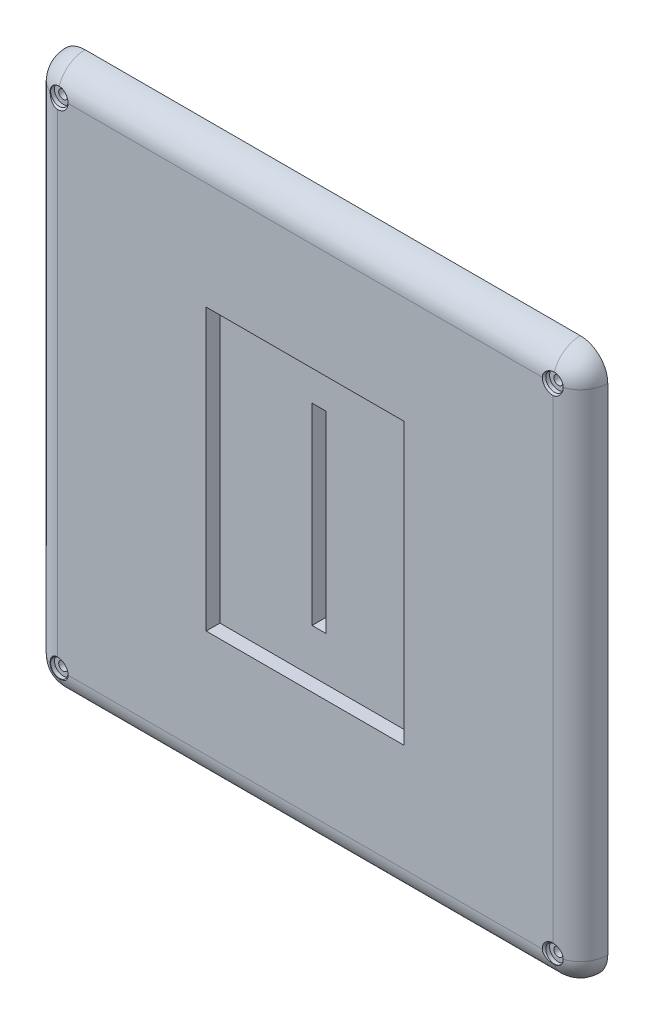
from build123d import *

# Parameters (mm, degrees)
CROQUIS3_W                                  = 200
CROQUIS3_H                                  = 200
SALIENTE_EXTRUIR1_DEPTH                     = 10
CROQUIS4_W                                  = 72
CROQUIS4_H                                  = 102
CORTAR_EXTRUIR2_DEPTH                       = 5
CROQUIS5_W                                  = 5
CROQUIS5_H                                  = 70
CORTAR_EXTRUIR3_DEPTH                       = 142.774468788
REDONDEO1_R                                 = 10
REDONDEO2_R                                 = 10
REDONDEO3_R                                 = 10
REDONDEO4_R                                 = 10
REDONDEO5_R                                 = 10
REFRENTADO_PARA_TORNILLO_CON_CABEZA_2_COUNT = 2
REFRENTADO_PARA_TORNILLO_CON_CABEZA_2_PITCH = 180
REFRENTADO_PARA_TORNILLO_CON_CABEZA_3_COUNT = 2
REFRENTADO_PARA_TORNILLO_CON_CABEZA_3_PITCH = 254.558441227
REFRENTADO_PARA_TORNILLO_CON_CABEZA_4_COUNT = 2
REFRENTADO_PARA_TORNILLO_CON_CABEZA_4_PITCH = 180


# Some blends are built 0.0001 mm under size
with BuildPart() as part:
    # Croquis3 → Saliente-Extruir1 (new body)
    with BuildSketch(Plane.XY):
        Rectangle(CROQUIS3_W, CROQUIS3_H)
    extrude(amount=SALIENTE_EXTRUIR1_DEPTH)

    # Croquis4 → Cortar-Extruir2 (cut)
    with BuildSketch(Plane.XY.offset(10)):
        Rectangle(CROQUIS4_W, CROQUIS4_H)
    extrude(amount=-CORTAR_EXTRUIR2_DEPTH, mode=Mode.SUBTRACT)

    # Croquis5 → Cortar-Extruir3 (cut, through all)
    with BuildSketch(Plane.XY.offset(10)):
        Rectangle(CROQUIS5_W, CROQUIS5_H)
    extrude(amount=-CORTAR_EXTRUIR3_DEPTH, mode=Mode.SUBTRACT)

    # Redondeo1
    redondeo1_edges = [part.edges().sort_by_distance(p)[0] for p in [
        (-100, 0, 10),
        (0, -100, 10),
        (100, 0, 10),
        (0, 100, 10),
    ]]
    fillet(redondeo1_edges, radius=REDONDEO1_R - 0.0001)  # a hair under: the kernel refuses the full size

    # Redondeo2
    # the kernel refuses this fillet: 10 mm, written as the material it takes off along each edge
    with BuildSketch(Plane(origin=(90, 90, 10), x_dir=(1, 0, 0), z_dir=(0, -1, 0))) as redondeo2_piece_1:
        with BuildLine():
            CenterArc((0.0001, -9.9999), 9.9999, 0, 90)
            Line((10, -9.9999), (10, 0))
            Line((10, 0), (0.0001, 0))
        make_face()
    revolve(axis=Axis((90, 90, 10), (0, 0, 1)), revolution_arc=90, mode=Mode.SUBTRACT)
    with BuildSketch(Plane(origin=(100, 100, -25), x_dir=(0, -1, 0), z_dir=(0, 0, 1))) as redondeo2_piece_2:
        with BuildLine():
            CenterArc((REDONDEO2_R, -REDONDEO2_R), REDONDEO2_R, 90, 90)
            Line((0, -REDONDEO2_R), (0, 0))
            Line((0, 0), (REDONDEO2_R, 0))
        make_face()
    extrude(amount=35, mode=Mode.SUBTRACT)

    # Redondeo3
    # the kernel refuses this fillet: 10 mm, written as the material it takes off along each edge
    with BuildSketch(Plane(origin=(-90, -90, 10), x_dir=(-1, 0, 0), z_dir=(0, 1, 0))) as redondeo3_piece_1:
        with BuildLine():
            CenterArc((0.0001, -9.9999), 9.9999, 0, 90)
            Line((10, -9.9999), (10, 0))
            Line((10, 0), (0.0001, 0))
        make_face()
    revolve(axis=Axis((-90, -90, 10), (0, 0, 1)), revolution_arc=90, mode=Mode.SUBTRACT)
    with BuildSketch(Plane(origin=(-100, -100, -25), x_dir=(1, 0, 0), z_dir=(0, 0, 1))) as redondeo3_piece_2:
        with BuildLine():
            CenterArc((REDONDEO3_R, REDONDEO3_R), REDONDEO3_R, 180, 90)
            Line((0, REDONDEO3_R), (0, 0))
            Line((0, 0), (REDONDEO3_R, 0))
        make_face()
    extrude(amount=35, mode=Mode.SUBTRACT)

    # Redondeo4
    # the kernel refuses this fillet: 10 mm, written as the material it takes off along each edge
    with BuildSketch(Plane(origin=(90, -90, 10), x_dir=(0, -1, 0), z_dir=(-1, 0, 0))) as redondeo4_piece_1:
        with BuildLine():
            CenterArc((0.0001, -9.9999), 9.9999, 0, 90)
            Line((10, -9.9999), (10, 0))
            Line((10, 0), (0.0001, 0))
        make_face()
    revolve(axis=Axis((90, -90, 10), (0, 0, 1)), revolution_arc=90, mode=Mode.SUBTRACT)
    with BuildSketch(Plane(origin=(100, -100, -25), x_dir=(-1, 0, 0), z_dir=(0, 0, 1))) as redondeo4_piece_2:
        with BuildLine():
            CenterArc((REDONDEO4_R, -REDONDEO4_R), REDONDEO4_R, 90, 90)
            Line((0, -REDONDEO4_R), (0, 0))
            Line((0, 0), (REDONDEO4_R, 0))
        make_face()
    extrude(amount=35, mode=Mode.SUBTRACT)

    # Redondeo5
    # the kernel refuses this fillet: 10 mm, written as the material it takes off along each edge
    with BuildSketch(Plane(origin=(-90, 90, 10), x_dir=(0, 1, 0), z_dir=(1, 0, 0))) as redondeo5_piece_1:
        with BuildLine():
            CenterArc((0.0001, -9.9999), 9.9999, 0, 90)
            Line((10, -9.9999), (10, 0))
            Line((10, 0), (0.0001, 0))
        make_face()
    revolve(axis=Axis((-90, 90, 10), (0, 0, 1)), revolution_arc=90, mode=Mode.SUBTRACT)
    with BuildSketch(Plane(origin=(-100, 100, -25), x_dir=(0, -1, 0), z_dir=(0, 0, 1))) as redondeo5_piece_2:
        with BuildLine():
            CenterArc((REDONDEO5_R, REDONDEO5_R), REDONDEO5_R, 180, 90)
            Line((0, REDONDEO5_R), (0, 0))
            Line((0, 0), (REDONDEO5_R, 0))
        make_face()
    extrude(amount=35, mode=Mode.SUBTRACT)

    # Croquis16 → Refrentado para tornillo con cabeza troncocónica de #45 (revolve, cut)
    with BuildSketch(Plane(origin=(-90, 90, 10), x_dir=(0, -1, 0), z_dir=(1, 0, 0))):
        Polygon((0, 0), (0, 10), (1.63195, 10), (1.63195, 2.032), (3.175, 2.032), (3.175, 0.635), (3.81, 0), align=None)
    refrentado_para_tornillo_con_cabeza_tron = revolve(axis=Axis((-90, 90, 16.35), (0, 0, -1)), mode=Mode.SUBTRACT)

    # Refrentado para tornillo con cabeza  2: Refrentado para tornillo con cabeza troncocónica de #45 ×2
    with Locations(*[(i * REFRENTADO_PARA_TORNILLO_CON_CABEZA_2_PITCH, 0, 0) for i in range(1, REFRENTADO_PARA_TORNILLO_CON_CABEZA_2_COUNT)]):
        add(refrentado_para_tornillo_con_cabeza_tron, mode=Mode.SUBTRACT)

    # Refrentado para tornillo con cabeza  3: Refrentado para tornillo con cabeza troncocónica de #45 ×2
    with Locations(*[Vector(0.7071067811865476, -0.7071067811865476, 0) * (i * REFRENTADO_PARA_TORNILLO_CON_CABEZA_3_PITCH) for i in range(1, REFRENTADO_PARA_TORNILLO_CON_CABEZA_3_COUNT)]):
        add(refrentado_para_tornillo_con_cabeza_tron, mode=Mode.SUBTRACT)

    # Refrentado para tornillo con cabeza  4: Refrentado para tornillo con cabeza troncocónica de #45 ×2
    with Locations(*[(0, -i * REFRENTADO_PARA_TORNILLO_CON_CABEZA_4_PITCH, 0) for i in range(1, REFRENTADO_PARA_TORNILLO_CON_CABEZA_4_COUNT)]):
        add(refrentado_para_tornillo_con_cabeza_tron, mode=Mode.SUBTRACT)


solid = part.part
